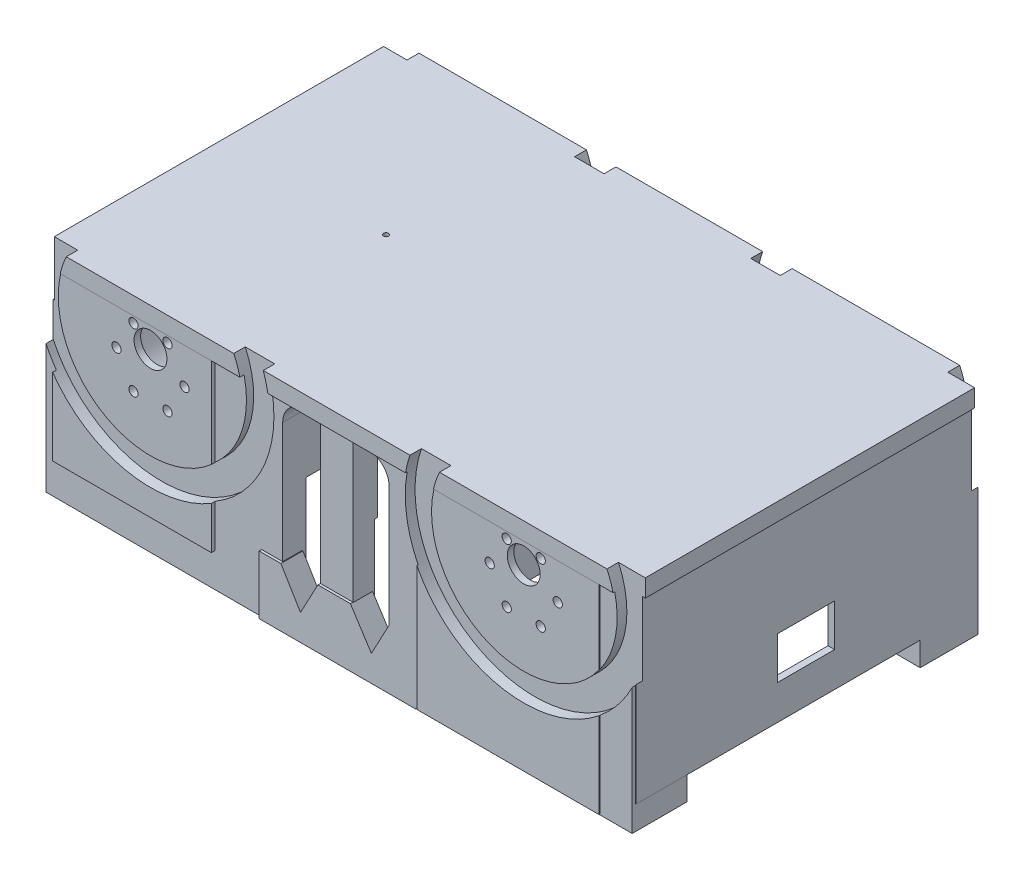
from build123d import *

# Parameters (mm, degrees)
MOTORHOLDERS_DEPTH            = 80
MOTORHOLDERS_DEPTH_BACK       = 80
MOTORHOLDERSSKETCH_R          = 23.41
MOTORHOLDERS_2_DEPTH          = 80
MOTORHOLDERS_2_DEPTH_BACK     = 80
SKETCH4_W                     = 262.774983374
SKETCH4_H                     = 153.112553215
CUT_EXTRUDE1_DEPTH            = 26
POWERBANKHOLDERS_DEPTH        = 40
POWERBANKHOLDERS_DEPTH_BACK   = 59
SKETCH6_W                     = 107.485666349
SKETCH6_H                     = 13.420779118
SKETCH6_W_2                   = 20.810206851
SKETCH6_H_2                   = 2.021058642
POWERBANKHOLDERS_2_DEPTH      = 40
POWERBANKHOLDERS_2_DEPTH_BACK = 59
SKETCH6_W_3                   = 107.81575089
SKETCH6_H_3                   = 38.261259506
SKETCH6_W_4                   = 10.842850571
SKETCH6_H_4                   = 10.347679347
POWERBANKHOLDERS_3_DEPTH      = 40
POWERBANKHOLDERS_3_DEPTH_BACK = 59
SKETCH6_W_5                   = 41.498763714
SKETCH6_H_5                   = 37.111507406
SKETCH6_W_6                   = 12.844328805
SKETCH6_H_6                   = 18.336479725
SKETCH6_W_7                   = 4.801433035
SKETCH6_H_7                   = 16.443461188
POWERBANKHOLDERS_4_DEPTH      = 40
POWERBANKHOLDERS_4_DEPTH_BACK = 59
SKETCH6_W_8                   = 41.763104176
SKETCH6_H_8                   = 35.272094794
SKETCH6_W_9                   = 11.134493861
SKETCH6_H_9                   = 18.035399163
SKETCH6_W_10                  = 4.654088682
SKETCH6_H_10                  = 14.436538778
POWERBANKHOLDERS_5_DEPTH      = 40
POWERBANKHOLDERS_5_DEPTH_BACK = 59
SKETCH6_W_11                  = 17.763333386
SKETCH6_H_11                  = 11.185766025
POWERBANKHOLDERS_6_DEPTH      = 40
POWERBANKHOLDERS_6_DEPTH_BACK = 59
SKETCH6_W_12                  = 14.811929009
SKETCH6_H_12                  = 11.030658464
POWERBANKHOLDERS_7_DEPTH      = 40
POWERBANKHOLDERS_7_DEPTH_BACK = 59
SKETCH6_W_13                  = 28.150495439
SKETCH6_H_13                  = 24.933985152
SKETCH6_W_14                  = 10.177859407
SKETCH6_H_14                  = 9.83070569
POWERBANKHOLDERS_8_DEPTH      = 40
POWERBANKHOLDERS_8_DEPTH_BACK = 59
SKETCH6_W_15                  = 30.670744753
SKETCH6_H_15                  = 26.330219561
SKETCH6_W_16                  = 9.898416255
SKETCH6_H_16                  = 10.635603546
BOTTOMPLATE_DEPTH             = 5
BOTTOMPLATE_DEPTH_BACK        = 3
SKETCH21_R                    = 156.395305675
SKETCH23_W                    = 72.331231332
SKETCH23_H                    = 81.163054316
SKETCH23_W_2                  = 82.936115801
SKETCH23_H_2                  = 96.211163908
MOTORMOUNTINGSUPPORT1_DEPTH   = 6
SKETCH24_W                    = 78.341994801
SKETCH24_H                    = 94.439711356
SKETCH24_W_2                  = 53.914675369
SKETCH24_H_2                  = 86.674739968
MOTORMOUNTINGSUPPOR2_DEPTH    = 6
SKETCH17_R                    = 2.1
SKETCH17_R_2                  = 7.5
MOTORHOLES1_DEPTH             = 31.5
SKETCH19_R                    = 2.1
SKETCH19_R_2                  = 7.5
CUT_EXTRUDE4_DEPTH            = 30
BOLTHOLESSKETCH3_R            = 2.1
BOLTHOLESSKETCH3_R_2          = 7.5
MOTORHOLES3_DEPTH             = 31.5
BOLTHOLESSKETCH4_R            = 2.1
BOLTHOLESSKETCH4_R_2          = 7.5
MOTORHOLES4_DEPTH             = 15
SKETCH29_W                    = 154.635205036
SKETCH29_H                    = 84.131588093
SKETCH29_W_2                  = 26
SKETCH29_H_2                  = 19.212652328
BOSS_EXTRUDE8_DEPTH           = 3
SKETCH27_W                    = 226.46009322
SKETCH27_H                    = 129.985211715
BOSS_EXTRUDE6_DEPTH           = 3
SKETCH40_W                    = 33.841577611
SKETCH40_H                    = 31.531825246
BOSS_EXTRUDE11_DEPTH          = 40
FILLET2_R                     = 15
FILLET3_R                     = 15
POWERBANKCUT_START            = -54.404272
POWERBANKCUT_DEPTH            = 54.404272
MOTORHOLDERCUT_DEPTH          = 77
MOTORHOLDERCUT_DEPTH_BACK     = 77
MOTORHOLDEREXTRUDESKETCH_R    = 20.415
BASEDEFININGCUT_DEPTH         = 20
BASEDEFININGCUT_DEPTH_BACK    = 20
SKETCH32_W                    = 420.045569038
SKETCH32_H                    = 425.046527557
SKETCH32_W_2                  = 269.205670794
SKETCH32_H_2                  = 160.645125556
SKETCH36_R                    = 7.790164171
CUT_EXTRUDE6_DEPTH            = 40
SKETCH37_W                    = 55.340133611
SKETCH37_H                    = 29.7708905
CUT_EXTRUDE7_DEPTH            = 36
SKETCH38_R                    = 1.145182774
CUT_EXTRUDE8_DEPTH            = 10
SPACEFORWHEEL1_DEPTH          = 10
SPACEFORWHEEL1_DEPTH_BACK     = 5
SKETCH41_R                    = 54.5
SKETCH41_R_2                  = 42
CUT_EXTRUDE10_DEPTH           = 10
CUT_EXTRUDE10_DEPTH_BACK      = 5
SKETCH42_R                    = 54.5
SKETCH42_R_2                  = 42
CUT_EXTRUDE11_DEPTH           = 10
CUT_EXTRUDE11_DEPTH_BACK      = 5
SKETCH43_R                    = 54.5
SKETCH43_R_2                  = 42
CUT_EXTRUDE12_DEPTH           = 10
CUT_EXTRUDE12_DEPTH_BACK      = 5
SKETCH44_R                    = 54.5
SKETCH44_R_2                  = 42
SKETCH45_W                    = 114.137539603
SKETCH45_H                    = 98.697181704
BACKPLATE_DEPTH               = 2
FILLET8_R                     = 10
FILLET9_R                     = 10
FILLET10_R                    = 10
FILLET11_R                    = 10
BOSS_EXTRUDE12_DEPTH          = 10
BOSS_EXTRUDE13_DEPTH          = 9


with BuildPart() as part:
    # MotorHoldersSketch → MotorHolders (new, two sides: drawn at the far end of the back side and taken through both)
    with BuildSketch(Plane.XY.offset(-MOTORHOLDERS_DEPTH_BACK)):
        Circle(MOTORHOLDERSSKETCH_R)
    extrude(amount=MOTORHOLDERS_DEPTH + MOTORHOLDERS_DEPTH_BACK)


with BuildPart() as body_2:
    # MotorHoldersSketch → MotorHolders 2 (new, two sides: drawn at the far end of the back side and taken through both)
    with BuildSketch(Plane.XY.offset(-MOTORHOLDERS_2_DEPTH_BACK)):
        with Locations((170, 0)):
            Circle(MOTORHOLDERSSKETCH_R)
    extrude(amount=MOTORHOLDERS_2_DEPTH + MOTORHOLDERS_2_DEPTH_BACK)


with BuildPart() as cut_extrude1_tool:
    # Sketch4 → Cut-Extrude1 (new body)
    with BuildSketch(Plane(origin=(0, 0, 0), x_dir=(1, 0, 0), z_dir=(0, 1, 0))):
        with Locations((89.893628689, 0.176832173)):
            Rectangle(SKETCH4_W, SKETCH4_H)
    extrude(amount=-CUT_EXTRUDE1_DEPTH)


with BuildPart() as part_1:
    add(part.part)

    # Cut-Extrude1: cut by cut_extrude1_tool
    add(cut_extrude1_tool.part, mode=Mode.SUBTRACT)


with BuildPart() as body_2_1:
    add(body_2.part)

    # Cut-Extrude1: cut by cut_extrude1_tool
    add(cut_extrude1_tool.part, mode=Mode.SUBTRACT)


with BuildPart() as body_3:
    # Sketch6 → PowerBankHolders (new, two sides: drawn at the far end of the back side and taken through both)
    with BuildSketch(Plane(origin=(170, -34.829272125, 0), x_dir=(-1, 0, 0), z_dir=(0, -1, 0)).offset(-POWERBANKHOLDERS_DEPTH_BACK)):
        with Locations((165.843013364, 72.238602394)):
            Rectangle(SKETCH6_W, SKETCH6_H)
        with Locations((203.359863582, 72.025840015)):
            Rectangle(SKETCH6_W_2, SKETCH6_H_2, mode=Mode.SUBTRACT)
    extrude(amount=POWERBANKHOLDERS_DEPTH + POWERBANKHOLDERS_DEPTH_BACK)



with BuildPart() as body_4:
    # Sketch6 → PowerBankHolders 2 (new, two sides: drawn at the far end of the back side and taken through both)
    with BuildSketch(Plane(origin=(170, -34.829272125, 0), x_dir=(-1, 0, 0), z_dir=(0, -1, 0)).offset(-POWERBANKHOLDERS_2_DEPTH_BACK)):
        with Locations((165.406852056, -59.151522269)):
            Rectangle(SKETCH6_W_3, SKETCH6_H_3)
        with Locations((206.519672379, -65.314281269)):
            Rectangle(SKETCH6_W_4, SKETCH6_H_4, mode=Mode.SUBTRACT)
    extrude(amount=POWERBANKHOLDERS_2_DEPTH + POWERBANKHOLDERS_2_DEPTH_BACK)


with BuildPart() as body_5:
    # Sketch6 → PowerBankHolders 3 (new, two sides: drawn at the far end of the back side and taken through both)
    with BuildSketch(Plane(origin=(170, -34.829272125, 0), x_dir=(-1, 0, 0), z_dir=(0, -1, 0)).offset(-POWERBANKHOLDERS_3_DEPTH_BACK)):
        with Locations((40.739743063, 59.306920349)):
            Rectangle(SKETCH6_W_5, SKETCH6_H_5)
        with Locations((34.93306737, 60.00949088)):
            Rectangle(SKETCH6_W_6, SKETCH6_H_6, mode=Mode.SUBTRACT)
        with Locations((56.270377412, 59.541495334)):
            Rectangle(SKETCH6_W_7, SKETCH6_H_7, mode=Mode.SUBTRACT)
    extrude(amount=POWERBANKHOLDERS_3_DEPTH + POWERBANKHOLDERS_3_DEPTH_BACK)


with BuildPart() as body_6:
    # Sketch6 → PowerBankHolders 4 (new, two sides: drawn at the far end of the back side and taken through both)
    with BuildSketch(Plane(origin=(170, -34.829272125, 0), x_dir=(-1, 0, 0), z_dir=(0, -1, 0)).offset(-POWERBANKHOLDERS_4_DEPTH_BACK)):
        with Locations((40.966801585, -61.807610384)):
            Rectangle(SKETCH6_W_8, SKETCH6_H_8)
        with Locations((37.73953158, -63.792391966)):
            Rectangle(SKETCH6_W_9, SKETCH6_H_9, mode=Mode.SUBTRACT)
        with Locations((54.037759341, -62.645522509)):
            Rectangle(SKETCH6_W_10, SKETCH6_H_10, mode=Mode.SUBTRACT)
    extrude(amount=POWERBANKHOLDERS_4_DEPTH + POWERBANKHOLDERS_4_DEPTH_BACK)


with BuildPart() as body_7:
    # Sketch6 → PowerBankHolders 5 (new, two sides: drawn at the far end of the back side and taken through both)
    with BuildSketch(Plane(origin=(170, -34.829272125, 0), x_dir=(-1, 0, 0), z_dir=(0, -1, 0)).offset(-POWERBANKHOLDERS_5_DEPTH_BACK)):
        with Locations((88.297855443, 73.356108941)):
            Rectangle(SKETCH6_W_11, SKETCH6_H_11)
    extrude(amount=POWERBANKHOLDERS_5_DEPTH + POWERBANKHOLDERS_5_DEPTH_BACK)


with BuildPart() as body_8:
    # Sketch6 → PowerBankHolders 6 (new, two sides: drawn at the far end of the back side and taken through both)
    with BuildSketch(Plane(origin=(170, -34.829272125, 0), x_dir=(-1, 0, 0), z_dir=(0, -1, 0)).offset(-POWERBANKHOLDERS_6_DEPTH_BACK)):
        with Locations((86.822153254, -72.76682279)):
            Rectangle(SKETCH6_W_12, SKETCH6_H_12)
    extrude(amount=POWERBANKHOLDERS_6_DEPTH + POWERBANKHOLDERS_6_DEPTH_BACK)


with BuildPart() as body_9:
    # Sketch6 → PowerBankHolders 7 (new, two sides: drawn at the far end of the back side and taken through both)
    with BuildSketch(Plane(origin=(170, -34.829272125, 0), x_dir=(-1, 0, 0), z_dir=(0, -1, 0)).offset(-POWERBANKHOLDERS_7_DEPTH_BACK)):
        with Locations((-34.775388772, -66.976665205)):
            Rectangle(SKETCH6_W_13, SKETCH6_H_13)
        with Locations((-36.725173705, -67.894738702)):
            Rectangle(SKETCH6_W_14, SKETCH6_H_14, mode=Mode.SUBTRACT)
    extrude(amount=POWERBANKHOLDERS_7_DEPTH + POWERBANKHOLDERS_7_DEPTH_BACK)


with BuildPart() as body_10:
    # Sketch6 → PowerBankHolders 8 (new, two sides: drawn at the far end of the back side and taken through both)
    with BuildSketch(Plane(origin=(170, -34.829272125, 0), x_dir=(-1, 0, 0), z_dir=(0, -1, 0)).offset(-POWERBANKHOLDERS_8_DEPTH_BACK)):
        with Locations((-33.722690809, 64.697564271)):
            Rectangle(SKETCH6_W_15, SKETCH6_H_15)
        with Locations((-36.585452129, 63.859928969)):
            Rectangle(SKETCH6_W_16, SKETCH6_H_16, mode=Mode.SUBTRACT)
    extrude(amount=POWERBANKHOLDERS_8_DEPTH + POWERBANKHOLDERS_8_DEPTH_BACK)


with BuildPart() as body_3_1:
    add(body_3.part)

    add(body_4.part)  # BottomPlate merges body 4

    add(body_2_1.part)  # BottomPlate merges body 2

    add(part_1.part)  # BottomPlate merges part

    add(body_5.part)  # BottomPlate merges body 5

    add(body_6.part)  # BottomPlate merges body 6
    # Sketch21 → BottomPlate (add, two sides: drawn at the far end of the back side and taken through both)
    with BuildSketch(Plane(origin=(0, 19.575, 0), x_dir=(1, 0, 0), z_dir=(0, 1, 0)).offset(-BOTTOMPLATE_DEPTH_BACK)):
        with Locations(Location((85, 0, 0), (0, 0, 270))):
            Circle(SKETCH21_R)
    extrude(amount=BOTTOMPLATE_DEPTH + BOTTOMPLATE_DEPTH_BACK)


    add(body_9.part)  # MotorMountingSupport1 merges body 9
    # Sketch23 → MotorMountingSupport1 (add)
    with BuildSketch(Plane.XY.offset(80)):
        with Locations((-8.424510745, -18.741332274)):
            Rectangle(SKETCH23_W, SKETCH23_H)
        with Locations((162.789906406, -26.26538707)):
            Rectangle(SKETCH23_W_2, SKETCH23_H_2)
    extrude(amount=-MOTORMOUNTINGSUPPORT1_DEPTH)


    add(body_10.part)  # MotorMountingSuppor2 merges body 10
    # Sketch24 → MotorMountingSuppor2 (add)
    with BuildSketch(Plane(origin=(0, 0, -80), x_dir=(-1, 0, 0), z_dir=(0, 0, -1))):
        with Locations((-163.019522912, -27.982448794)):
            Rectangle(SKETCH24_W, SKETCH24_H)
        with Locations((2.593149567, -20.814772641)):
            Rectangle(SKETCH24_W_2, SKETCH24_H_2)
    extrude(amount=-MOTORMOUNTINGSUPPOR2_DEPTH)

    # Sketch17 → MotorHoles1 (cut)
    with BuildSketch(Plane.XY.offset(80)):
        with Locations((185.5, 0)):
            Circle(SKETCH17_R)
        with Locations((177.75, -13.42)):
            Circle(SKETCH17_R)
        with Locations((162.25, -13.42)):
            Circle(SKETCH17_R)
        with Locations((154.5, 0)):
            Circle(SKETCH17_R)
        with Locations((162.25, 13.42)):
            Circle(SKETCH17_R)
        with Locations((177.75, 13.42)):
            Circle(SKETCH17_R)
        with Locations((170, 7)):
            Circle(SKETCH17_R_2)
    extrude(amount=-MOTORHOLES1_DEPTH, mode=Mode.SUBTRACT)

    # Sketch19 → Cut-Extrude4 (cut)
    with BuildSketch(Plane(origin=(0, 0, -80), x_dir=(-1, 0, 0), z_dir=(0, 0, -1))):
        with Locations(Location((-185.5, 0, 0), (0, 0, 180))):
            Circle(SKETCH19_R)
        with Locations(Location((-177.75, -13.42, 0), (0, 0, 180))):
            Circle(SKETCH19_R)
        with Locations(Location((-162.25, -13.42, 0), (0, 0, 180))):
            Circle(SKETCH19_R)
        with Locations(Location((-154.5, 0, 0), (0, 0, 180))):
            Circle(SKETCH19_R)
        with Locations(Location((-162.25, 13.42, 0), (0, 0, 180))):
            Circle(SKETCH19_R)
        with Locations(Location((-177.75, 13.42, 0), (0, 0, 180))):
            Circle(SKETCH19_R)
        with Locations(Location((-170, 7, 0), (0, 0, 180))):
            Circle(SKETCH19_R_2)
    extrude(amount=-CUT_EXTRUDE4_DEPTH, mode=Mode.SUBTRACT)

    # BoltHolesSketch3 → MotorHoles3 (cut)
    with BuildSketch(Plane.XY.offset(80)):
        with Locations((7.75, -13.42)):
            Circle(BOLTHOLESSKETCH3_R)
        with Locations((15.5, 0)):
            Circle(BOLTHOLESSKETCH3_R)
        with Locations((7.75, 13.42)):
            Circle(BOLTHOLESSKETCH3_R)
        with Locations((-7.75, 13.42)):
            Circle(BOLTHOLESSKETCH3_R)
        with Locations((-15.5, 0)):
            Circle(BOLTHOLESSKETCH3_R)
        with Locations((-7.75, -13.42)):
            Circle(BOLTHOLESSKETCH3_R)
        with Locations((0, 7)):
            Circle(BOLTHOLESSKETCH3_R_2)
    extrude(amount=-MOTORHOLES3_DEPTH, mode=Mode.SUBTRACT)

    # BoltHolesSketch4 → MotorHoles4 (cut)
    with BuildSketch(Plane(origin=(0, 0, -80), x_dir=(-1, 0, 0), z_dir=(0, 0, -1))):
        with Locations(Location((-15.5, 0, 0), (0, 0, 180))):
            Circle(BOLTHOLESSKETCH4_R)
        with Locations(Location((-7.75, 13.42, 0), (0, 0, 180))):
            Circle(BOLTHOLESSKETCH4_R)
        with Locations(Location((7.75, 13.42, 0), (0, 0, 180))):
            Circle(BOLTHOLESSKETCH4_R)
        with Locations(Location((15.5, 0, 0), (0, 0, 180))):
            Circle(BOLTHOLESSKETCH4_R)
        with Locations(Location((7.75, -13.42, 0), (0, 0, 180))):
            Circle(BOLTHOLESSKETCH4_R)
        with Locations(Location((-7.75, -13.42, 0), (0, 0, 180))):
            Circle(BOLTHOLESSKETCH4_R)
        with Locations(Location((0, 7, 0), (0, 0, 180))):
            Circle(BOLTHOLESSKETCH4_R_2)
    extrude(amount=-MOTORHOLES4_DEPTH, mode=Mode.SUBTRACT)

    # Sketch29 → Boss-Extrude8 (add)
    with BuildSketch(Plane(origin=(219.058063185, 0, 0), x_dir=(0, 0, -1), z_dir=(1, 0, 0))):
        with Locations((-0.622085312, -21.859578752)):
            Rectangle(SKETCH29_W, SKETCH29_H)
        with Locations((-0.45071267, -38.546737855)):
            Rectangle(SKETCH29_W_2, SKETCH29_H_2, mode=Mode.SUBTRACT)
    extrude(amount=-BOSS_EXTRUDE8_DEPTH)

    # Sketch27 → Boss-Extrude6 (add)
    with BuildSketch(Plane(origin=(0, 16.575, 0), x_dir=(-1, 0, 0), z_dir=(0, -1, 0))):
        with Locations((-81.596376522, -0.440920076)):
            Rectangle(SKETCH27_W, SKETCH27_H)
    extrude(amount=-BOSS_EXTRUDE6_DEPTH)

    # Sketch40 → Boss-Extrude11 (add)
    with BuildSketch(Plane.XZ.offset(-16.575)):
        with Locations((-32.665057733, -49.762300212)):
            Rectangle(SKETCH40_W, SKETCH40_H)
    extrude(amount=BOSS_EXTRUDE11_DEPTH)

    # Fillet2
    fillet2_edges = [body_3_1.edges().sort_by_distance(p)[0] for p in [
        (-33.058778866, 16.575, -33.996387589),
    ]]
    fillet(fillet2_edges, radius=FILLET2_R)

    # Fillet3
    fillet3_edges = [body_3_1.edges().sort_by_distance(p)[0] for p in [
        (-32.665057733, -23.425, -65.528212835),
    ]]
    fillet(fillet3_edges, radius=FILLET3_R)


with BuildPart() as powerbankcut_tool:
    # Sketch11 → PowerBankCut (new body)
    with BuildSketch(Plane(origin=(0, -20.425, 0), x_dir=(1, 0, 0), z_dir=(0, 1, 0)).offset(POWERBANKCUT_START)):
        Polygon((-34.216190018, -64.758061011), (-34.216190018, 73.342459946), (204.216190018, 63.61100878), (204.216190018, -72.195407715), align=None)
    extrude(amount=POWERBANKCUT_DEPTH)


with BuildPart() as body_3_2:
    add(body_3_1.part)

    # PowerBankCut: cut by powerbankcut_tool
    add(powerbankcut_tool.part, mode=Mode.SUBTRACT)

    # MotorHolderExtrudeSketch → MotorHolderCut (cut, two sides: drawn at the far end of the back side and taken through both)
    with BuildSketch(Plane.XY.offset(-MOTORHOLDERCUT_DEPTH_BACK)):
        with Locations((170, 0)):
            Circle(MOTORHOLDEREXTRUDESKETCH_R)
        Circle(MOTORHOLDEREXTRUDESKETCH_R)
    extrude(amount=MOTORHOLDERCUT_DEPTH + MOTORHOLDERCUT_DEPTH_BACK, mode=Mode.SUBTRACT)

    # Sketch32 → BaseDefiningCut (cut, two sides: drawn at the far end of the back side and taken through both)
    with BuildSketch(Plane(origin=(0, 19.575, 0), x_dir=(1, 0, 0), z_dir=(0, 1, 0)).offset(-BASEDEFININGCUT_DEPTH_BACK)):
        with Locations((73.53385004, -6.203492346)):
            Rectangle(SKETCH32_W, SKETCH32_H)
        with Locations((85.789158114, 0.107563087)):
            Rectangle(SKETCH32_W_2, SKETCH32_H_2, mode=Mode.SUBTRACT)
    extrude(amount=BASEDEFININGCUT_DEPTH + BASEDEFININGCUT_DEPTH_BACK, mode=Mode.SUBTRACT)

    # Sketch36 → Cut-Extrude6 (cut)
    with BuildSketch(Plane.ZY.offset(49.314727501)):
        with Locations((49.382152022, -38.368879339)):
            Circle(SKETCH36_R)
    extrude(amount=-CUT_EXTRUDE6_DEPTH, mode=Mode.SUBTRACT)

    # Sketch37 → Cut-Extrude7 (cut)
    with BuildSketch(Plane.XZ.offset(20.425)):
        with Locations((116.745978541, -50.558354808)):
            Rectangle(SKETCH37_W, SKETCH37_H)
    extrude(amount=-CUT_EXTRUDE7_DEPTH, mode=Mode.SUBTRACT)

    # Sketch38 → Cut-Extrude8 (cut)
    with BuildSketch(Plane.XZ.offset(-16.575)):
        with Locations(Location((25.99644574, -1.316498015, 0), (0, 0, 270))):
            Circle(SKETCH38_R)
    extrude(amount=-CUT_EXTRUDE8_DEPTH, mode=Mode.SUBTRACT)

    # Sketch41 → SpaceForWheel1 (cut, two sides: drawn at the far end of the back side and taken through both)
    with BuildSketch(Plane.XY.offset(80).offset(-SPACEFORWHEEL1_DEPTH_BACK)):
        with Locations((0, 7)):
            Circle(SKETCH41_R)
        with Locations((0, 7)):
            Circle(SKETCH41_R_2, mode=Mode.SUBTRACT)
    extrude(amount=SPACEFORWHEEL1_DEPTH + SPACEFORWHEEL1_DEPTH_BACK, mode=Mode.SUBTRACT)

    # Sketch42 → Cut-Extrude10 (cut, two sides: drawn at the far end of the back side and taken through both)
    with BuildSketch(Plane.XY.offset(80).offset(-CUT_EXTRUDE10_DEPTH_BACK)):
        with Locations((170, 7)):
            Circle(SKETCH42_R)
        with Locations((170, 7)):
            Circle(SKETCH42_R_2, mode=Mode.SUBTRACT)
    extrude(amount=CUT_EXTRUDE10_DEPTH + CUT_EXTRUDE10_DEPTH_BACK, mode=Mode.SUBTRACT)

    # Sketch43 → Cut-Extrude11 (cut, two sides: drawn at the far end of the back side and taken through both)
    with BuildSketch(Plane(origin=(0, 0, -80), x_dir=(-1, 0, 0), z_dir=(0, 0, -1)).offset(-CUT_EXTRUDE11_DEPTH_BACK)):
        with Locations((-170, 7)):
            Circle(SKETCH43_R)
        with Locations((-170, 7)):
            Circle(SKETCH43_R_2, mode=Mode.SUBTRACT)
    extrude(amount=CUT_EXTRUDE11_DEPTH + CUT_EXTRUDE11_DEPTH_BACK, mode=Mode.SUBTRACT)

    # Sketch44 → Cut-Extrude12 (cut, two sides: drawn at the far end of the back side and taken through both)
    with BuildSketch(Plane(origin=(0, 0, -80), x_dir=(-1, 0, 0), z_dir=(0, 0, -1)).offset(-CUT_EXTRUDE12_DEPTH_BACK)):
        with Locations((0, 7)):
            Circle(SKETCH44_R)
        with Locations((0, 7)):
            Circle(SKETCH44_R_2, mode=Mode.SUBTRACT)
    extrude(amount=CUT_EXTRUDE12_DEPTH + CUT_EXTRUDE12_DEPTH_BACK, mode=Mode.SUBTRACT)

    # Sketch45 → BackPlate (add)
    with BuildSketch(Plane.ZY.offset(48.813677283)):
        with Locations((-15.037538426, -24.773590852)):
            Rectangle(SKETCH45_W, SKETCH45_H)
    extrude(amount=-BACKPLATE_DEPTH)

    # Fillet8
    fillet8_edges = [body_3_2.edges().sort_by_distance(p)[0] for p in [
        (57.89981981, 16.575, -72.238602394),
    ]]
    fillet(fillet8_edges, radius=FILLET8_R)

    # Fillet9
    # the kernel refuses this fillet: 10 mm, written as the material it adds along each edge
    with BuildSketch(Plane(origin=(108.51087508, 16.575, -77.862674052), x_dir=(0, -1, 0), z_dir=(0, 0, 1))) as fillet9_piece_1_section:
        with BuildLine():
            CenterArc((FILLET9_R, -FILLET9_R), FILLET9_R, 90, 90)
            Line((0, -FILLET9_R), (0, 0))
            Line((0, 0), (FILLET9_R, 0))
        make_face()
    fillet9_piece_1 = extrude(amount=37.111507406, mode=Mode.PRIVATE)
    fillet9_piece_1 = split(fillet9_piece_1, bisect_by=Plane(origin=(107.13497171, 15.575, -71.653237055), z_dir=(0, -1, 0)), keep=Keep.TOP, mode=Mode.PRIVATE)
    fillet9_piece_1 = split(fillet9_piece_1, bisect_by=Plane(origin=(107.13497171, 13.204405478, -65.443800058), z_dir=(0, 0, -1)), keep=Keep.TOP, mode=Mode.PRIVATE)
    add(fillet9_piece_1)
    with BuildSketch(Plane(origin=(108.51087508, 16.575, -77.862674052), x_dir=(0, -1, 0), z_dir=(0, 0, 1))) as fillet9_piece_2_section:
        with BuildLine():
            CenterArc((FILLET9_R, -FILLET9_R), FILLET9_R, 90, 90)
            Line((0, -FILLET9_R), (0, 0))
            Line((0, 0), (FILLET9_R, 0))
        make_face()
    fillet9_piece_2 = extrude(amount=37.111507406, mode=Mode.PRIVATE)
    fillet9_piece_2 = split(fillet9_piece_2, bisect_by=Plane(origin=(104.700954064, 15.575, -71.653237055), z_dir=(0, 1, 0)), keep=Keep.TOP, mode=Mode.PRIVATE)
    fillet9_piece_2 = split(fillet9_piece_2, bisect_by=Plane(origin=(104.700954064, 16.237563822, -65.443800058), z_dir=(0, 0, -1)), keep=Keep.TOP, mode=Mode.PRIVATE)
    add(fillet9_piece_2)
    with BuildSketch(Plane(origin=(108.51087508, 16.575, -77.862674052), x_dir=(0, -1, 0), z_dir=(0, 0, 1))) as fillet9_piece_3_section:
        with BuildLine():
            CenterArc((FILLET9_R, -FILLET9_R), FILLET9_R, 90, 90)
            Line((0, -FILLET9_R), (0, 0))
            Line((0, 0), (FILLET9_R, 0))
        make_face()
    fillet9_piece_3 = extrude(amount=37.111507406, mode=Mode.PRIVATE)
    fillet9_piece_3 = split(fillet9_piece_3, bisect_by=Plane(origin=(104.700954064, 15.575, -53.097483352), z_dir=(0, 1, 0)), keep=Keep.TOP, mode=Mode.PRIVATE)
    fillet9_piece_3 = split(fillet9_piece_3, bisect_by=Plane(origin=(104.700954064, 16.237563822, -65.443800058), z_dir=(0, 0, 1)), keep=Keep.TOP, mode=Mode.PRIVATE)
    add(fillet9_piece_3)

    # Fillet10
    fillet10_edges = [body_3_2.edges().sort_by_distance(p)[0] for p in [
        (108.151646327, 16.575, 61.807610384),
    ]]
    fillet(fillet10_edges, radius=FILLET10_R)

    # Fillet11
    fillet11_edges = [body_3_2.edges().sort_by_distance(p)[0] for p in [
        (58.501023389, 16.575, 59.151522269),
    ]]
    fillet(fillet11_edges, radius=FILLET11_R)



with BuildPart() as body_7_1:
    add(body_7.part)

    # PowerBankCut: cut by powerbankcut_tool
    add(powerbankcut_tool.part, mode=Mode.SUBTRACT)


with BuildPart() as body_8_1:
    add(body_8.part)

    # PowerBankCut: cut by powerbankcut_tool
    add(powerbankcut_tool.part, mode=Mode.SUBTRACT)


with BuildPart() as body_3_3:
    add(body_3_2.part)

    add(body_8_1.part)  # Boss-Extrude12 merges body 8
    # Sketch51 → Boss-Extrude12 (add)
    with BuildSketch(Plane.XY.offset(79.443657781)):
        Polygon((108.151646327, -47.98038528), (100.046955512, -63.179220835), (90.516348019, -48.336772286), (75.676177949, -48.336772286), (67.761528435, -63.179220835), (58.839832918, -48.336772286), (48.929052362, -48.336772286), (48.929052362, -75.040734929), (120.251371925, -75.040734929), (120.251371925, -47.98038528), align=None)
    extrude(amount=-BOSS_EXTRUDE12_DEPTH)


    add(body_7_1.part)  # Boss-Extrude13 merges body 7
    # Sketch53 → Boss-Extrude13 (add)
    with BuildSketch(Plane(origin=(0, 0, -77.862674052), x_dir=(-1, 0, 0), z_dir=(0, 0, -1))):
        Polygon((-57.799247354, -55.761623835), (-64.666800666, -65.107182533), (-72.754062458, -55.761623835), (-90.655375706, -55.761623835), (-98.668066194, -65.107182533), (-108.51087508, -55.761623835), (-123.848525511, -55.761623835), (-123.848525511, -74.829272125), (-52.438264255, -74.829272125), (-52.438264255, -55.761623835), align=None)
    extrude(amount=-BOSS_EXTRUDE13_DEPTH)


solid = body_3_3.part
